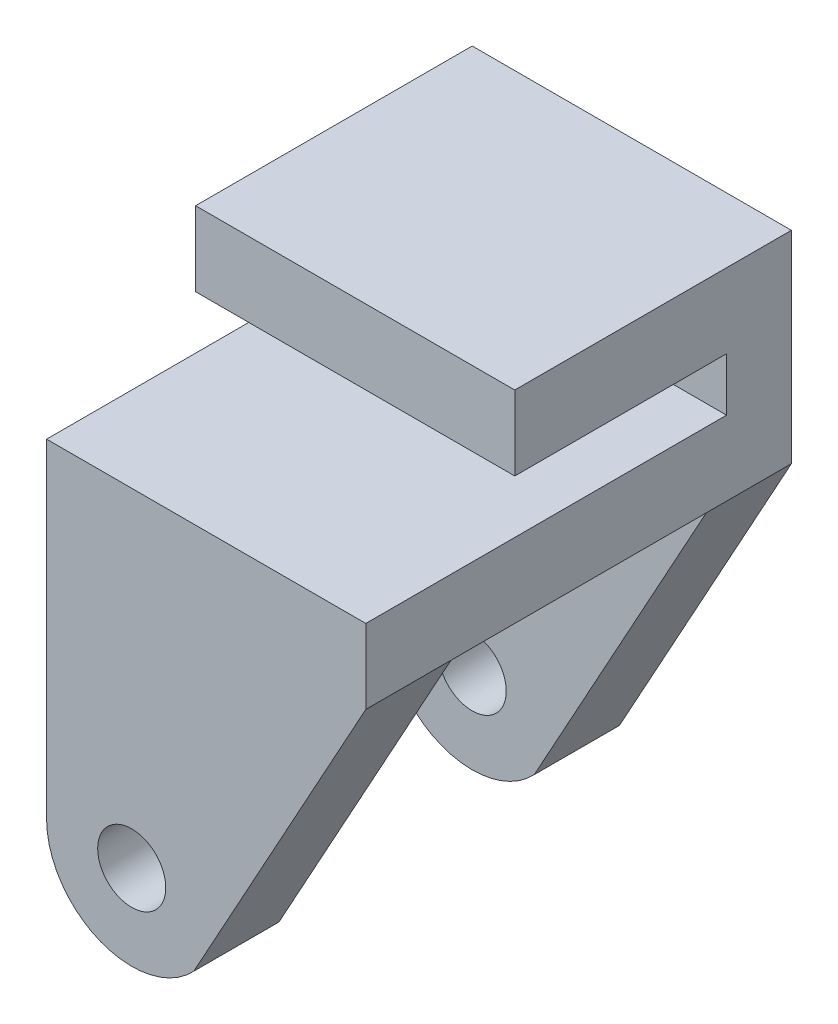
from build123d import *

# Parameters (mm, degrees)
SKETCH1_W               = 20
SKETCH1_H               = 9.5
BOSS_EXTRUDE1_DEPTH     = 15
CUT_EXTRUDE1_DEPTH      = 27.744158241
SKETCH4_R               = 1.6
BOSS_EXTRUDE3_DEPTH     = 4
MIRROR2_COPY_1_SKETCH_R = 1.6
MIRROR2_COPY_1_DEPTH    = 4
SKETCH5_W               = 15.5626007
SKETCH5_H               = 27.716948025
CUT_EXTRUDE2_DEPTH      = 30.659067152


with BuildPart() as part:
    # Sketch1 → Boss-Extrude1 (new body)
    with BuildSketch(Plane(origin=(0, 0, 0), x_dir=(0, 0, -1), z_dir=(1, 0, 0))):
        with Locations((10, 4.75)):
            Rectangle(SKETCH1_W, SKETCH1_H)
    boss_extrude1 = extrude(amount=BOSS_EXTRUDE1_DEPTH)

    # Sketch2 → Cut-Extrude1 (cut, symmetric)
    with BuildSketch(Plane(origin=(15, 0, 0), x_dir=(0, 0, -1), z_dir=(1, 0, 0))):
        Polygon((20, 3.5), (3.047520991, 3.5), (3.047520991, 6), (13, 6), (13, 9.5), (20, 9.5), (20, 6.3375), align=None)
    cut_extrude1 = extrude(amount=CUT_EXTRUDE1_DEPTH, both=True, mode=Mode.SUBTRACT)

    # Sketch4 → Boss-Extrude3 (add)
    with BuildSketch(Plane.XY):
        with BuildLine():
            Line((0, 0), (0, -12))
            ThreePointArc((0, -12), (2.54815314, -15.685380119), (6.917654828, -14.694135419))
            Line((6.917654828, -14.694135419), (15, 0))
            Line((15, 0), (0, 0))
        make_face()
        with Locations((3.999780316, -11.958078341)):
            Circle(SKETCH4_R, mode=Mode.SUBTRACT)
    boss_extrude3 = extrude(amount=-BOSS_EXTRUDE3_DEPTH)

    # Mirror1: Boss-Extrude3 across plane
    add(boss_extrude3.mirror(Plane.XY.offset(-10)))

    # Mirror2: Boss-Extrude1, Cut-Extrude1, Boss-Extrude3 across plane
    add(boss_extrude1.mirror(Plane(origin=(15, 0, -20), x_dir=(1, 0, 0), z_dir=(0, 0, 1))))
    add(cut_extrude1.mirror(Plane(origin=(15, 0, -20), x_dir=(1, 0, 0), z_dir=(0, 0, 1))), mode=Mode.SUBTRACT)
    add(boss_extrude3.mirror(Plane(origin=(15, 0, -20), x_dir=(1, 0, 0), z_dir=(0, 0, 1))))

    # Mirror2 copy 1 sketch → Mirror2 copy 1 (add)
    with BuildSketch(Plane.XY.offset(-20)):
        with BuildLine():
            Line((0, 0), (0, -12))
            ThreePointArc((0, -12), (2.54815314, -15.685380119), (6.917654828, -14.694135419))
            Line((6.917654828, -14.694135419), (15, 0))
            Line((15, 0), (0, 0))
        make_face()
        with Locations((3.999780316, -11.958078341)):
            Circle(MIRROR2_COPY_1_SKETCH_R, mode=Mode.SUBTRACT)
    extrude(amount=-MIRROR2_COPY_1_DEPTH)

    # Sketch5 → Cut-Extrude2 (cut, through all)
    with BuildSketch(Plane.XY.offset(-20)):
        with Locations((7.481159079, -3.991929402)):
            Rectangle(SKETCH5_W, SKETCH5_H)
    extrude(amount=CUT_EXTRUDE2_DEPTH, mode=Mode.SUBTRACT)


solid = part.part
